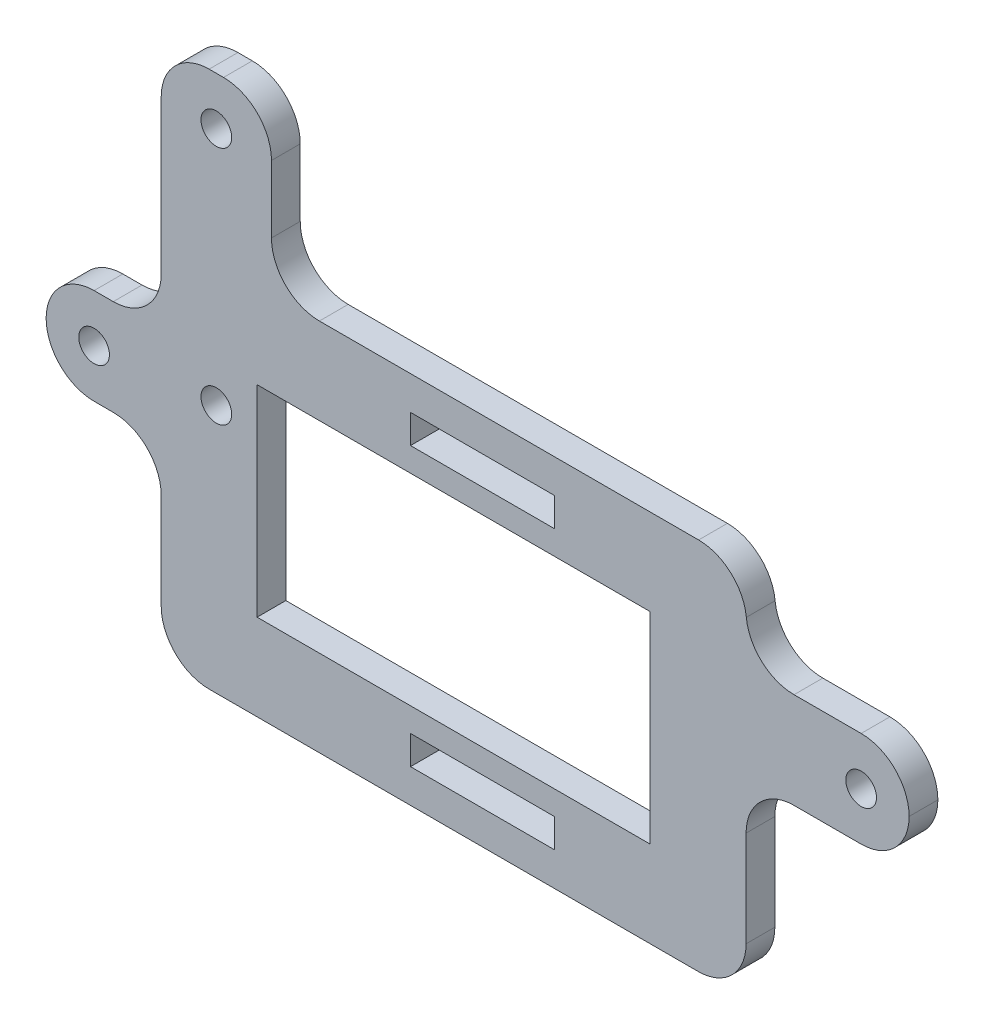
from build123d import *

# Parameters (mm, degrees)
ESBO_O1_R                = 1.6
ESBO_O1_W                = 41
ESBO_O1_H                = 21
ESBO_O1_W_2              = 15
ESBO_O1_H_2              = 3
RESSALTO_EXTRUS_O1_DEPTH = 3
FILETE1_R                = 5
FILETE4_R                = 5


with BuildPart() as part:
    # Esboço1 → Ressalto-extrusão1 (new body)
    with BuildSketch(Plane.XY):
        Polygon((-30.5, 0.5), (-30.5, -19.5), (30.5, -19.5), (30.5, 0.5), (47.5, 0.5), (47.5, 10.5), (30.5, 10.5), (30.5, 19.5), (-19, 19.5), (-19, 36.5), (-30.5, 36.5), (-30.5, 10.5), (-42.5, 10.5), (-42.5, 0.5), align=None)
        with Locations((-24.75, 6.5)):
            Circle(ESBO_O1_R, mode=Mode.SUBTRACT)
        Rectangle(ESBO_O1_W, ESBO_O1_H, mode=Mode.SUBTRACT)
        with Locations((3, -14.5)):
            Rectangle(ESBO_O1_W_2, ESBO_O1_H_2, mode=Mode.SUBTRACT)
        with Locations((3, 14.5)):
            Rectangle(ESBO_O1_W_2, ESBO_O1_H_2, mode=Mode.SUBTRACT)
        with Locations((-37.5, 5.5)):
            Circle(ESBO_O1_R, mode=Mode.SUBTRACT)
        with Locations((42.5, 5.5)):
            Circle(ESBO_O1_R, mode=Mode.SUBTRACT)
        with Locations((-24.75, 31.5)):
            Circle(ESBO_O1_R, mode=Mode.SUBTRACT)
    extrude(amount=RESSALTO_EXTRUS_O1_DEPTH)

    # Filete1
    filete1_edges = [part.edges().sort_by_distance(p)[0] for p in [
        (-19, 36.5, 1.5),
        (-30.5, 36.5, 1.5),
        (30.5, -19.5, 1.5),
        (-30.5, -19.5, 1.5),
        (-42.5, 0.5, 1.5),
        (-19, 19.5, 1.5),
        (-30.5, 0.5, 1.5),
        (-30.5, 10.5, 1.5),
        (-42.5, 10.5, 1.5),
        (30.5, 0.5, 1.5),
        (47.5, 0.5, 1.5),
        (47.5, 10.5, 1.5),
        (30.5, 10.5, 1.5),
    ]]
    fillet(filete1_edges, radius=FILETE1_R - 0.0001)  # a hair under: the kernel refuses the full size

    # Filete4
    filete4_edges = [part.edges().sort_by_distance(p)[0] for p in [
        (30.5, 19.5, 1.5),
    ]]
    fillet(filete4_edges, radius=FILETE4_R)


solid = part.part
